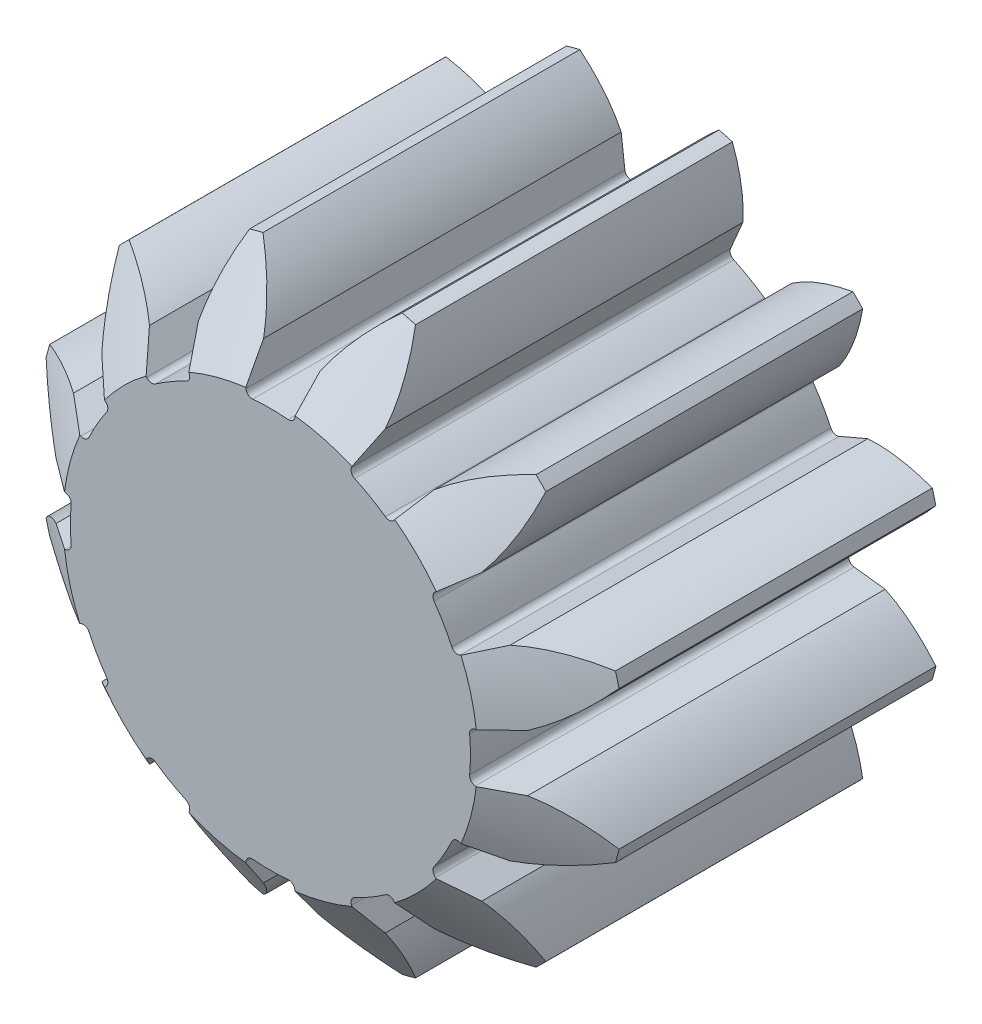
from build123d import *

# Parameters (mm, degrees)
SKETCH_993_R                     = 14
EXTRUDE_1013_DEPTH               = 11
CHAMFER_1052_SIZE                = 1
CUT_EXTRUDE_1361_DEPTH           = 11
FILLET_1_R                       = 0.3
PATTERN_CIRCULAR_1_COUNT         = 12
FILLET_1_OF_PATTERN_CIRCULAR_1_R = 0.3
CUT_EXTRUDE_1_DEPTH              = 20
EXTRUDE_START                    = -4
EXTRUDE_1_DEPTH                  = 4
SKETCH_9_R                       = 30
CUT_EXTRUDE_3_DEPTH              = 4


with BuildPart() as part:
    # Sketch 993 → Extrude 1013 (new, symmetric)
    with BuildSketch(Plane.XY):
        Circle(SKETCH_993_R)
    extrude(amount=EXTRUDE_1013_DEPTH, both=True)

    # Chamfer 1052
    chamfer_1052_edges = [part.edges().sort_by_distance(p)[0] for p in [
        (-14, 0, -11),
        (-14, 0, 11),
    ]]
    chamfer(chamfer_1052_edges, length=CHAMFER_1052_SIZE)

    # 草图2 → Cut-Extrude 1361 (cut, symmetric)
    with BuildSketch(Plane.XY):
        with BuildLine():
            Line((-1.341184722, 11.196268282), (-1.129913351, 9.432565707))
            ThreePointArc((-1.129913351, 9.432565707), (0, 9.5), (1.129913351, 9.432565707))
            Line((1.129913351, 9.432565707), (1.341184722, 11.196268282))
            add(Edge.make_bspline(
                [(1.341184722, 11.196268282), (1.414293036, 11.350540251), (1.624779651, 11.745542433), (2.041341603, 12.361851293), (2.565650703, 12.946401078), (3.015269016, 13.362307362), (3.272062477, 13.578260096), (3.303754738, 13.604602333)],
                knots=[0.018362333, 0.018362333, 0.018362333, 0.018362333, 0.018362333, 0.029959916, 0.048733667, 0.068727063, 0.071526609, 0.071526609, 0.071526609, 0.071526609, 0.071526609], degree=4))
            ThreePointArc((3.303754738, 13.604602333), (-3e-09, 14), (-3.303754743, 13.604602332))
            add(Edge.make_bspline(
                [(-1.341184722, 11.196268282), (-1.414293035, 11.350540248), (-1.624779649, 11.745542427), (-2.041341599, 12.361851284), (-2.5656507, 12.94640107), (-3.015269015, 13.362307356), (-3.272062479, 13.578260092), (-3.303754743, 13.604602331)],
                knots=[0.018362333, 0.018362333, 0.018362333, 0.018362333, 0.018362333, 0.029959916, 0.048733667, 0.068727063, 0.071526609, 0.071526609, 0.071526609, 0.071526609, 0.071526609], degree=4))
        make_face()
    cut_extrude_1361 = extrude(amount=CUT_EXTRUDE_1361_DEPTH, both=True, mode=Mode.SUBTRACT)

    # 圆角1
    fillet_1_edges = [part.edges().sort_by_distance(p)[0] for p in [
        (1.129913351, 9.432565707, 0),
        (-1.129913351, 9.432565707, 0),
    ]]
    fillet(fillet_1_edges, radius=FILLET_1_R)

    # 圆周阵列1: Cut-Extrude 1361 ×12 about axis
    pattern_circular_1_axis = Axis((0, 0, 11), (0, 0, -1))
    for i in range(1, PATTERN_CIRCULAR_1_COUNT):
        add(cut_extrude_1361.rotate(pattern_circular_1_axis, i * 360 / PATTERN_CIRCULAR_1_COUNT), mode=Mode.SUBTRACT)

    # 圆角1 of 圆周阵列1
    fillet_1_of_pattern_circular_1_edges = [part.edges().sort_by_distance(p)[0] for p in [
        (5.69481652, 7.60388485, 0),
        (3.737749187, 8.733798201, 0),
        (8.733798201, 3.737749187, 0),
        (7.60388485, 5.69481652, 0),
        (9.432565707, -1.129913351, 0),
        (9.432565707, 1.129913351, 0),
        (7.60388485, -5.69481652, 0),
        (8.733798201, -3.737749187, 0),
        (3.737749187, -8.733798201, 0),
        (5.69481652, -7.60388485, 0),
        (-1.129913351, -9.432565707, 0),
        (1.129913351, -9.432565707, 0),
        (-5.69481652, -7.60388485, 0),
        (-3.737749187, -8.733798201, 0),
        (-8.733798201, -3.737749187, 0),
        (-7.60388485, -5.69481652, 0),
        (-9.432565707, 1.129913351, 0),
        (-9.432565707, -1.129913351, 0),
        (-7.60388485, 5.69481652, 0),
        (-8.733798201, 3.737749187, 0),
        (-3.737749187, 8.733798201, 0),
        (-5.69481652, 7.60388485, 0),
    ]]
    fillet(fillet_1_of_pattern_circular_1_edges, radius=FILLET_1_OF_PATTERN_CIRCULAR_1_R)

    # 草图4 → 切除-拉伸1 (cut)
    with BuildSketch(Plane(origin=(0, 0, -11), x_dir=(-1, 0, 0), z_dir=(0, 0, -1))):
        with BuildLine():
            Line((1.65, 2.2), (-1.65, 2.2))
            ThreePointArc((-1.65, 2.2), (-1.229837388, -2.459674775), (2.75, 0))
            ThreePointArc((2.75, 0), (2.459674775, 1.229837388), (1.65, 2.2))
        make_face()
    extrude(amount=-CUT_EXTRUDE_1_DEPTH, mode=Mode.SUBTRACT)

    # 草图6 → 切除-旋转1 (revolve, cut)
    with BuildSketch(Plane(origin=(0, 0, 0), x_dir=(0, 0, -1), z_dir=(1, 0, 0))):
        Polygon((-11, 9.846622114), (-7.8, 14.346622114), (-11, 14.346622114), align=None)
    revolve(axis=Axis((0, 0, 0), (0, 0, -1)), mode=Mode.SUBTRACT)

    # 草图7 → 凸台-拉伸1 (add)
    with BuildSketch(Plane.XY.offset(11).offset(EXTRUDE_START)):
        with BuildLine():
            Line((1.65, 2.2), (-1.65, 2.2))
            ThreePointArc((-1.65, 2.2), (0, 2.75), (1.65, 2.2))
        make_face()
    extrude(amount=EXTRUDE_1_DEPTH)

    # 草图9 → 切除-拉伸3 (cut)
    with BuildSketch(Plane(origin=(0, 0, -11), x_dir=(-1, 0, 0), z_dir=(0, 0, -1))):
        Circle(SKETCH_9_R)
    extrude(amount=-CUT_EXTRUDE_3_DEPTH, mode=Mode.SUBTRACT)


solid = part.part
